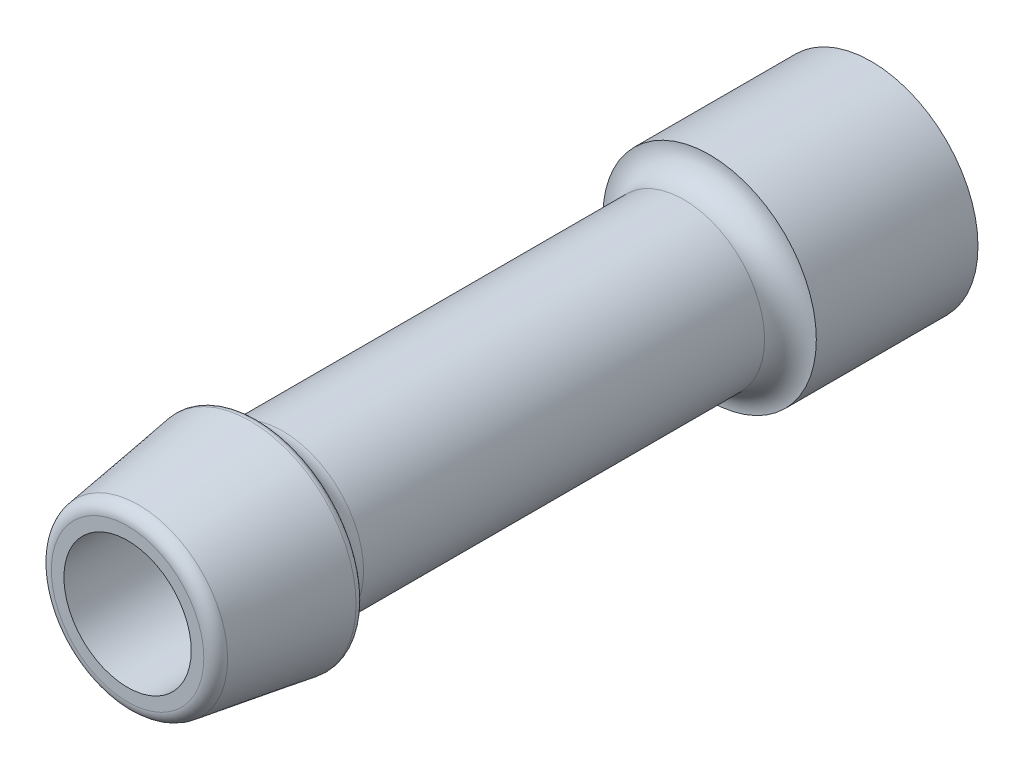
from build123d import *

# Parameters (mm, degrees)
SKETCH1_R           = 4.191
BOSS_EXTRUDE1_DEPTH = 29.21
SKETCH2_R           = 2.5
CUT_EXTRUDE1_START  = -5.08
SKETCH3_R           = 5.08
SKETCH3_R_2         = 3.175
CUT_EXTRUDE1_DEPTH  = 17.78
FILLET1_R           = 1.016
FILLET2_R           = 1.016
CHAMFER1_SIZE       = 5.08
CHAMFER1_SIZE_2     = 0.759211087
FILLET3_R           = 0.254
FILLET4_R           = 0.508


# Some blends are built 0.0001 mm under size
with BuildPart() as part:
    # Sketch1 → Boss-Extrude1 (new body)
    with BuildSketch(Plane.XY):
        with Locations(Location((0, 0, 0), (0, 0, 180))):
            Circle(SKETCH1_R)
    extrude(amount=BOSS_EXTRUDE1_DEPTH)

    # Cut-Sweep1: sweep along a curve in space
    with BuildLine() as cut_sweep1_path:
        Line((0, 0, 29.21), (0, 0, 0))
    # Sketch2 → Cut-Sweep1 (sweep, cut)
    with BuildSketch(Plane.XY.offset(29.21)):
        Circle(SKETCH2_R)
    sweep(path=cut_sweep1_path.line, mode=Mode.SUBTRACT)

    # Sketch3 → Cut-Extrude1 (cut)
    with BuildSketch(Plane.XY.offset(29.21).offset(CUT_EXTRUDE1_START)):
        Circle(SKETCH3_R)
        Circle(SKETCH3_R_2, mode=Mode.SUBTRACT)
    extrude(amount=-CUT_EXTRUDE1_DEPTH, mode=Mode.SUBTRACT)

    # Fillet1
    fillet1_edges = [part.edges().sort_by_distance(p)[0] for p in [
        (-3.175, 0, 6.35),
    ]]
    fillet(fillet1_edges, radius=FILLET1_R - 0.0001)  # a hair under: the kernel refuses the full size

    # Fillet2
    fillet2_edges = [part.edges().sort_by_distance(p)[0] for p in [
        (-3.175, 0, 24.13),
    ]]
    fillet(fillet2_edges, radius=FILLET2_R - 0.0001)  # a hair under: the kernel refuses the full size

    # Chamfer1
    # the kernel refuses this chamfer: 5.08, 0.759211087 mm, written as the material it takes off along each edge
    with BuildSketch(Plane(origin=(0, 0, 29.21), x_dir=(-1, 0, 0), z_dir=(0, 1, 0))) as chamfer1_piece_1:
        Polygon((4.191, -CHAMFER1_SIZE), (4.191 - CHAMFER1_SIZE_2, 0), (4.191, 0), align=None)
    revolve(axis=Axis((0, 0, 29.21), (0, 0, 1)), mode=Mode.SUBTRACT)

    # Fillet3
    fillet3_edges = [part.edges().sort_by_distance(p)[0] for p in [
        (4.191, 0, 24.13),
    ]]
    fillet(fillet3_edges, radius=FILLET3_R)

    # Fillet4
    fillet4_edges = [part.edges().sort_by_distance(p)[0] for p in [
        (3.431788913, 0, 29.21),
    ]]
    fillet(fillet4_edges, radius=FILLET4_R)


solid = part.part
